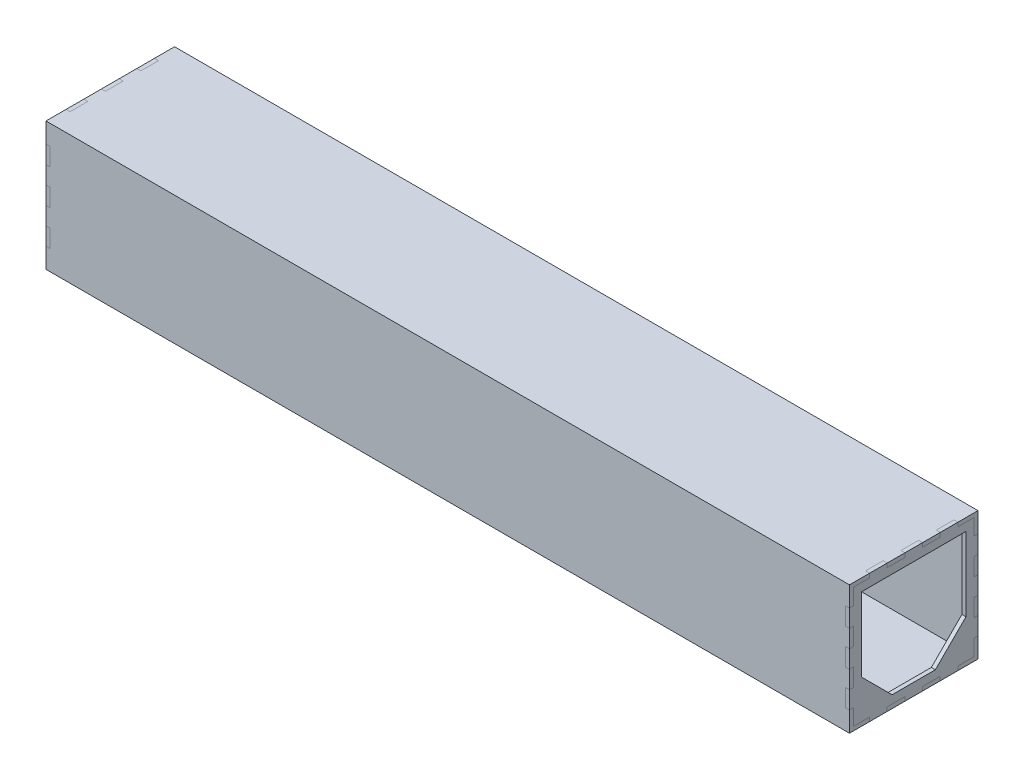
from build123d import *

# Parameters (mm, degrees)
SKETCH1_W           = 101.6
SKETCH1_H           = 101.6
SKETCH1_W_2         = 95.25
SKETCH1_H_2         = 95.25
BOSS_EXTRUDE1_DEPTH = 628.65
SKETCH3_W           = 13.97
SKETCH3_H           = 3.175
SKETCH3_W_2         = 3.175
SKETCH3_H_2         = 13.97
BOSS_EXTRUDE3_DEPTH = 3.175
BOSS_EXTRUDE4_DEPTH = 3.175
BOSS_EXTRUDE5_DEPTH = 3.175
SKETCH6_W           = 3.175
SKETCH6_H           = 13.97
SKETCH6_W_2         = 13.97
SKETCH6_H_2         = 3.175
BOSS_EXTRUDE6_DEPTH = 3.175


with BuildPart() as part:
    # Sketch1 → Boss-Extrude1 (new body)
    with BuildSketch(Plane(origin=(0, 0, 0), x_dir=(0, 0, -1), z_dir=(1, 0, 0))):
        with Locations((-50.8, 50.8)):
            Rectangle(SKETCH1_W, SKETCH1_H)
        with Locations((-50.8, 50.8)):
            Rectangle(SKETCH1_W_2, SKETCH1_H_2, mode=Mode.SUBTRACT)
    extrude(amount=BOSS_EXTRUDE1_DEPTH)

    # Sketch3 → Boss-Extrude3 (add)
    with BuildSketch(Plane.ZY):
        Polygon((0, 85.725), (3.175, 85.725), (3.175, 98.425), (15.875, 98.425), (15.875, 101.6), (0, 101.6), align=None)
        with Locations((36.83, 100.0125)):
            Rectangle(SKETCH3_W, SKETCH3_H)
        with Locations((1.5875, 64.77)):
            Rectangle(SKETCH3_W_2, SKETCH3_H_2)
        with Locations((100.0125, 64.77)):
            Rectangle(SKETCH3_W_2, SKETCH3_H_2)
        with Locations((64.77, 100.0125)):
            Rectangle(SKETCH3_W, SKETCH3_H)
        Polygon((98.425, 98.425), (85.725, 98.425), (85.725, 101.6), (101.6, 101.6), (101.6, 85.725), (98.425, 85.725), align=None)
        Polygon((101.6, 15.875), (98.425, 15.875), (98.425, 3.175), (85.725, 3.175), (85.725, 0), (101.6, 0), align=None)
        with Locations((64.77, 1.5875)):
            Rectangle(SKETCH3_W, SKETCH3_H)
        with Locations((100.0125, 36.83)):
            Rectangle(SKETCH3_W_2, SKETCH3_H_2)
        with Locations((1.5875, 36.83)):
            Rectangle(SKETCH3_W_2, SKETCH3_H_2)
        with Locations((36.83, 1.5875)):
            Rectangle(SKETCH3_W, SKETCH3_H)
        Polygon((3.175, 3.175), (15.875, 3.175), (15.875, 0), (0, 0), (0, 15.875), (3.175, 15.875), align=None)
    extrude(amount=BOSS_EXTRUDE3_DEPTH)

    # Sketch6 → Boss-Extrude6 (add)
    with BuildSketch(Plane(origin=(628.65, 0, 0), x_dir=(0, 0, -1), z_dir=(1, 0, 0))):
        with Locations((-100.0125, 36.83)):
            Rectangle(SKETCH6_W, SKETCH6_H)
        with Locations((-100.0125, 64.77)):
            Rectangle(SKETCH6_W, SKETCH6_H)
        Polygon((-98.425, 98.425), (-98.425, 85.725), (-101.6, 85.725), (-101.6, 101.6), (-85.725, 101.6), (-85.725, 98.425), align=None)
        with Locations((-64.77, 100.0125)):
            Rectangle(SKETCH6_W_2, SKETCH6_H_2)
        with Locations((-36.83, 100.0125)):
            Rectangle(SKETCH6_W_2, SKETCH6_H_2)
        Polygon((0, 101.6), (0, 85.725), (-3.175, 85.725), (-3.175, 98.425), (-15.875, 98.425), (-15.875, 101.6), align=None)
        with Locations((-1.5875, 64.77)):
            Rectangle(SKETCH6_W, SKETCH6_H)
        with Locations((-1.5875, 36.83)):
            Rectangle(SKETCH6_W, SKETCH6_H)
        Polygon((-3.175, 3.175), (-3.175, 15.875), (0, 15.875), (0, 0), (-15.875, 0), (-15.875, 3.175), align=None)
        with Locations((-36.83, 1.5875)):
            Rectangle(SKETCH6_W_2, SKETCH6_H_2)
        with Locations((-64.77, 1.5875)):
            Rectangle(SKETCH6_W_2, SKETCH6_H_2)
        Polygon((-101.6, 0), (-101.6, 15.875), (-98.425, 15.875), (-98.425, 3.175), (-85.725, 3.175), (-85.725, 0), align=None)
    extrude(amount=BOSS_EXTRUDE6_DEPTH)


with BuildPart() as body_2:
    # Sketch4 → Boss-Extrude4 (new body)
    with BuildSketch(Plane.ZY):
        Polygon((15.875, 101.6), (15.875, 98.425), (3.175, 98.425), (3.175, 85.725), (0, 85.725), (0, 71.755), (3.175, 71.755), (3.175, 57.785), (0, 57.785), (0, 43.815), (3.175, 43.815), (3.175, 29.845), (0, 29.845), (0, 15.875), (3.175, 15.875), (3.175, 3.175), (15.875, 3.175), (15.875, 0), (29.845, 0), (29.845, 3.175), (43.815, 3.175), (43.815, 0), (57.785, 0), (57.785, 3.175), (71.755, 3.175), (71.755, 0), (85.725, 0), (85.725, 3.175), (98.425, 3.175), (98.425, 15.875), (101.6, 15.875), (101.6, 29.845), (98.425, 29.845), (98.425, 43.815), (101.6, 43.815), (101.6, 57.785), (98.425, 57.785), (98.425, 71.755), (101.6, 71.755), (101.6, 85.725), (98.425, 85.725), (98.425, 98.425), (85.725, 98.425), (85.725, 101.6), (71.755, 101.6), (71.755, 98.425), (57.785, 98.425), (57.785, 101.6), (43.815, 101.6), (43.815, 98.425), (29.845, 98.425), (29.845, 101.6), align=None)
    extrude(amount=BOSS_EXTRUDE4_DEPTH)


with BuildPart() as body_3:
    # Sketch5 → Boss-Extrude5 (new body)
    with BuildSketch(Plane(origin=(628.65, 0, 0), x_dir=(0, 0, -1), z_dir=(1, 0, 0))):
        Polygon((-29.845, 101.6), (-29.845, 98.425), (-43.815, 98.425), (-43.815, 101.6), (-57.785, 101.6), (-57.785, 98.425), (-71.755, 98.425), (-71.755, 101.6), (-85.725, 101.6), (-85.725, 98.425), (-98.425, 98.425), (-98.425, 85.725), (-101.6, 85.725), (-101.6, 71.755), (-98.425, 71.755), (-98.425, 57.785), (-101.6, 57.785), (-101.6, 43.815), (-98.425, 43.815), (-98.425, 29.845), (-101.6, 29.845), (-101.6, 15.875), (-98.425, 15.875), (-98.425, 3.175), (-85.725, 3.175), (-85.725, 0), (-71.755, 0), (-71.755, 3.175), (-57.785, 3.175), (-57.785, 0), (-43.815, 0), (-43.815, 3.175), (-29.845, 3.175), (-29.845, 0), (-15.875, 0), (-15.875, 3.175), (-3.175, 3.175), (-3.175, 15.875), (0, 15.875), (0, 29.845), (-3.175, 29.845), (-3.175, 43.815), (0, 43.815), (0, 57.785), (-3.175, 57.785), (-3.175, 71.755), (0, 71.755), (0, 85.725), (-3.175, 85.725), (-3.175, 98.425), (-15.875, 98.425), (-15.875, 101.6), align=None)
        Polygon((-92.075, 33.703335213), (-92.075, 92.075), (-9.525, 92.075), (-9.525, 33.703335213), (-33.703335213, 9.525), (-67.896664787, 9.525), align=None, mode=Mode.SUBTRACT)
    extrude(amount=BOSS_EXTRUDE5_DEPTH)


solid = Compound([part.part, body_2.part, body_3.part])
